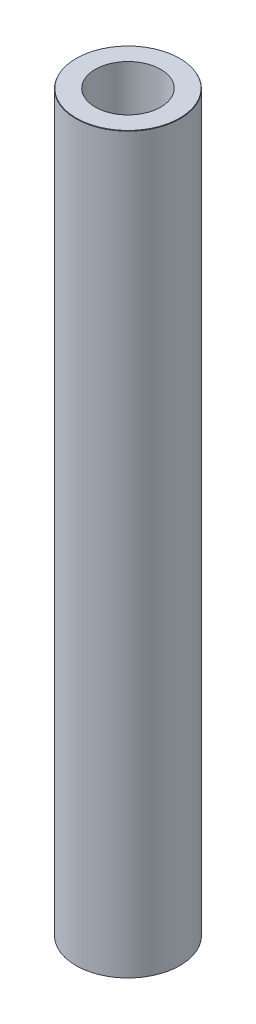
from build123d import *
from OCP.BRepFilletAPI import BRepFilletAPI_MakeChamfer

# Parameters (mm, degrees)
SKETCH1_R           = 42.5
BOSS_EXTRUDE1_DEPTH = 600
SKETCH2_R           = 26.755728638
CUT_EXTRUDE1_DEPTH  = 604.002902149
CHAMFER1_SIZE       = 0.367982774
CHAMFER1_SIZE2      = 0.212454954


with BuildPart() as part:
    # Sketch1 → Boss-Extrude1 (new body)
    with BuildSketch(Plane(origin=(0, 0, 0), x_dir=(1, 0, 0), z_dir=(0, 1, 0))):
        Circle(SKETCH1_R)
    extrude(amount=BOSS_EXTRUDE1_DEPTH)

    # Sketch2 → Cut-Extrude1 (cut, through all)
    with BuildSketch(Plane(origin=(0, 0, 0), x_dir=(1, 0, 0), z_dir=(0, 1, 0))):
        Circle(SKETCH2_R)
    extrude(amount=CUT_EXTRUDE1_DEPTH, mode=Mode.SUBTRACT)

    # Chamfer1: one chamfer whose edges measure the first distance from different faces: ONE call of the kernel's chamfer builder (chamfer() names one face for all edges)
    chamfer1_edges_1 = [part.edges().sort_by_distance(p)[0] for p in [
        (-42.5, 600, 0),
    ]]
    chamfer1_side_1 = [part.faces().sort_by_distance(p)[0] for p in [
        (-42.5, 300, 0),
    ]]
    chamfer1_edges_2 = [part.edges().sort_by_distance(p)[0] for p in [
        (-42.5, 0, 0),
    ]]
    chamfer1_side_2 = [part.faces().sort_by_distance(p)[0] for p in [
        (-41.297918472, 0, 0),
    ]]
    chamfer1 = BRepFilletAPI_MakeChamfer(part.part.solid().wrapped)
    for e in chamfer1_edges_1:
        chamfer1.Add(CHAMFER1_SIZE, CHAMFER1_SIZE2, e.wrapped, chamfer1_side_1[0].wrapped)  # the first distance lies on this face
    for e in chamfer1_edges_2:
        chamfer1.Add(CHAMFER1_SIZE, CHAMFER1_SIZE2, e.wrapped, chamfer1_side_2[0].wrapped)  # the first distance lies on this face
    add(Compound.cast(chamfer1.Shape()), mode=Mode.REPLACE)


solid = part.part
